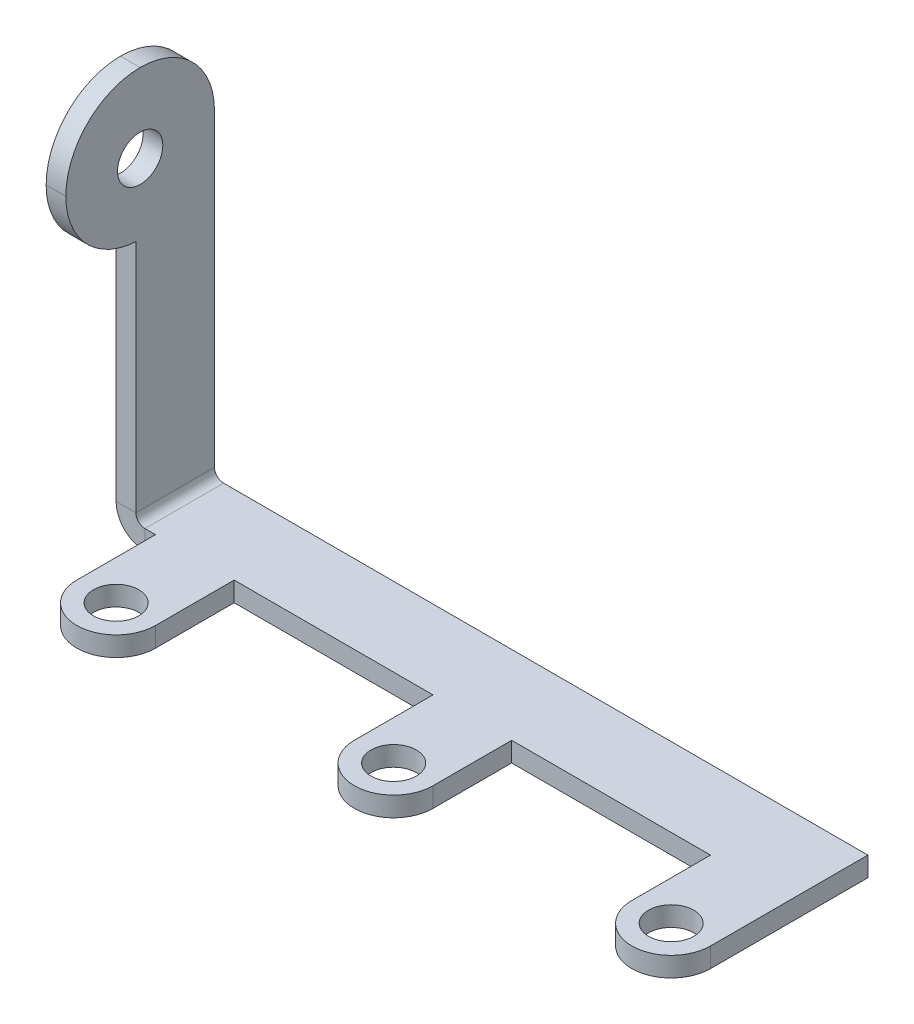
from build123d import *

# Parameters (mm, degrees)
SKETCH1_R                    = 1.8288
BASE_FLANGE1_DEPTH           = 1.5875
EDGE_FLANGE2_STRIP_W         = 7.8232
EDGE_FLANGE2_STRIP_H         = 1.5875
EDGE_FLANGE2_STRIP_CUT_DEPTH = 6.35
EDGE_FLANGE2_DEPTH           = 6.35
SKETCH19_W                   = 5.65
SKETCH19_H                   = 12
TAB1_DEPTH                   = 1.5875
HOLE1_START                  = -28.75
HOLE1_OUTLINE_R              = 1.8288
HOLE1_DEPTH                  = 1.5875
FILLET1_R                    = 6


# Read off the part's stored shape, not the designer's step: Hole1
# Sheet-metal steps are written as plain solids
with BuildPart() as part:
    # Sketch1 → Base-Flange1 (new body)
    with BuildSketch(Plane(origin=(0, 0, 0), x_dir=(1, 0, 0), z_dir=(0, 1, 0))):
        with BuildLine():
            Line((-25.575, 0), (-25.575, 6.35))
            Line((-25.575, 6.35), (-27.1625, 6.35))
            Line((-27.1625, 6.35), (-27.1625, 12.7))
            Line((-27.1625, 12.7), (0, 12.7))
            Line((0, 12.7), (25.575, 12.7))
            Line((25.575, 12.7), (25.575, 0))
            ThreePointArc((25.575, 0), (22.4, -3.175), (19.225, 0))
            Line((19.225, 0), (19.225, 6.35))
            Line((19.225, 6.35), (3.175, 6.35))
            Line((3.175, 6.35), (3.175, 0))
            ThreePointArc((3.175, 0), (0, -3.175), (-3.175, 0))
            Line((-3.175, 0), (-3.175, 6.35))
            Line((-3.175, 6.35), (-19.225, 6.35))
            Line((-19.225, 6.35), (-19.225, 0))
            ThreePointArc((-19.225, 0), (-22.4, -3.175), (-25.575, 0))
        make_face()
        with Locations(Location((0, 0, 0), (0, 0, 270))):
            Circle(SKETCH1_R, mode=Mode.SUBTRACT)
        with Locations(Location((22.4, 0, 0), (0, 0, 270))):
            Circle(SKETCH1_R, mode=Mode.SUBTRACT)
        with Locations(Location((-22.4, 0, 0), (0, 0, 270))):
            Circle(SKETCH1_R, mode=Mode.SUBTRACT)
    extrude(amount=BASE_FLANGE1_DEPTH)

    # Edge-Flange2 strip (across the edge) → Edge-Flange2 strip cut (cut)
    with BuildSketch(Plane(origin=(-27.1625, 1.5875, -12.7), x_dir=(1, 0, 0), z_dir=(0, 0, 1))):
        with Locations((-3.175, -0.79375)):
            Rectangle(EDGE_FLANGE2_STRIP_W, EDGE_FLANGE2_STRIP_H)
    extrude(amount=EDGE_FLANGE2_STRIP_CUT_DEPTH, mode=Mode.SUBTRACT)

    # Edge-Flange2 section (across the edge) → Edge-Flange2 (add)
    with BuildSketch(Plane(origin=(-27.1625, 1.5875, -12.7), x_dir=(1, 0, 0), z_dir=(0, 0, 1))):
        with BuildLine():
            Line((-1.5875, 0.7366), (-1.5875, 31.688))
            Line((-1.5875, 31.688), (0, 31.688))
            Line((0, 31.688), (0, 0.7366))
            ThreePointArc((0, 0.7366), (0.215745145, 0.215745145), (0.7366, 0))
            Line((0.7366, 0), (0.7366, -1.5875))
            ThreePointArc((0.7366, -1.5875), (-0.90678687, -0.90678687), (-1.5875, 0.7366))
        make_face()
    extrude(amount=EDGE_FLANGE2_DEPTH)

    # Sketch19 → Tab1 (add)
    with BuildSketch(Plane.ZY.offset(28.75)):
        with Locations((-3.525, 27.2755)):
            Rectangle(SKETCH19_W, SKETCH19_H)
    extrude(amount=-TAB1_DEPTH)

    # Hole1 outline → Hole1 (cut)
    with BuildSketch(Plane.YZ.offset(HOLE1_START)):
        with Locations((26.9255, -6.7)):
            Circle(HOLE1_OUTLINE_R)
    extrude(amount=HOLE1_DEPTH, mode=Mode.SUBTRACT)

    # Fillet1
    # the kernel refuses this fillet: 6 mm, written as the material it takes off along each edge
    with BuildSketch(Plane(origin=(-43.724457419, 21.2755, -0.7), x_dir=(0, 0, -1), z_dir=(1, 0, 0))) as fillet1_piece_1:
        with BuildLine():
            CenterArc((6, 5.989782968), FILLET1_R, 180, 86.655847796)
            Line((0, 5.989782968), (-0.12, 5.989782968))
            Line((-0.12, 5.989782968), (-0.12, 0))
            Line((-0.12, 0), (0, -0.12))
            ThreePointArc((0, -0.12), (2.825, -0.12), (5.643, -0.119795659))
            Line((5.643, -0.119795659), (5.65, 0))
        make_face()
    extrude(amount=31.536414838, mode=Mode.SUBTRACT)
    with BuildSketch(Plane(origin=(-43.75, 33.2755, -0.7), x_dir=(0, 0, -1), z_dir=(1, 0, 0)), Plane(origin=(-43.75, 33.2755, -12.7), x_dir=(0, -1, 0), z_dir=(1, 0, 0))) as fillet1_piece_2:
        with BuildLine():
            CenterArc((FILLET1_R, -FILLET1_R), FILLET1_R, 90, 90)
            Line((0, -FILLET1_R), (-FILLET1_R * 0.02, -FILLET1_R))
            Line((-FILLET1_R * 0.02, -FILLET1_R), (-FILLET1_R * 0.02, FILLET1_R * 0.02))
            Line((-FILLET1_R * 0.02, FILLET1_R * 0.02), (FILLET1_R, FILLET1_R * 0.02))
            Line((FILLET1_R, FILLET1_R * 0.02), (FILLET1_R, 0))
        make_face()
    extrude(amount=31.5875, mode=Mode.SUBTRACT)


solid = part.part
